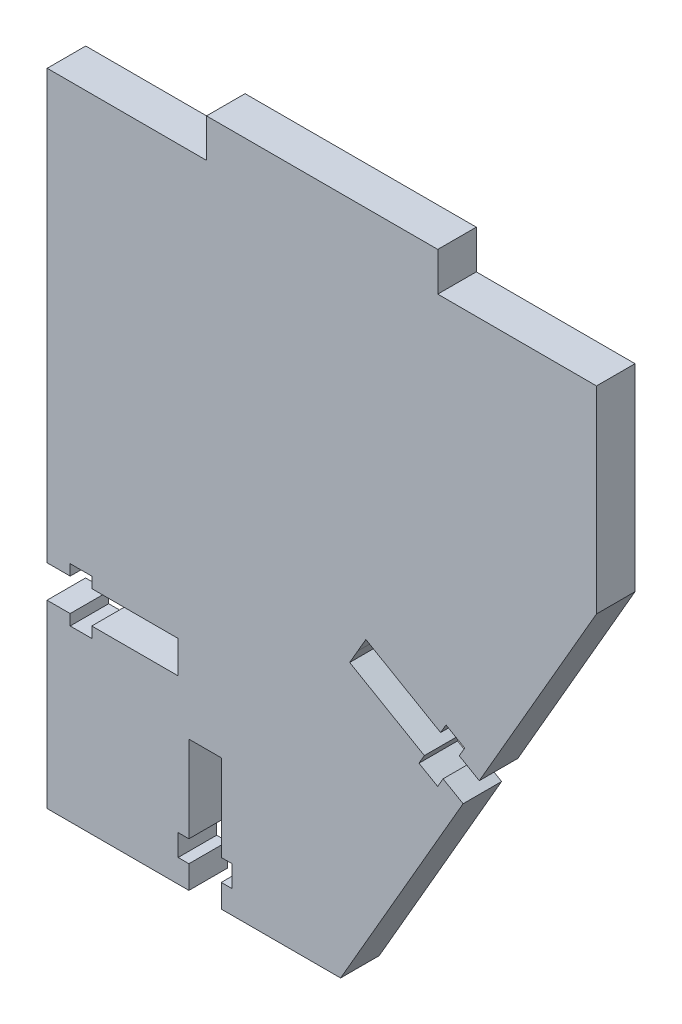
from build123d import *

# Parameters (mm, degrees)
BOSS_EXTRUDE1_DEPTH = 5
CUT_EXTRUDE3_START  = -5
CUT_EXTRUDE3_DEPTH  = 5
BOSS_EXTRUDE2_DEPTH = 5


# Read off the part's stored shape, not the designer's step: Cut-Extrude3
with BuildPart() as part:
    # Sketch1 → Boss-Extrude1 (new body)
    with BuildSketch(Plane.XY):
        Polygon((-35.261138019, -40.918717749), (2.830677256, -40.918717749), (3.530317734, -39.706904894), (36.028317734, 16.581282251), (36.028317734, 42.200866684), (-35.231632156, 42.261282251), align=None)
    extrude(amount=BOSS_EXTRUDE1_DEPTH)

    # Cut-Extrude3 outline → Cut-Extrude3 (cut)
    with BuildSketch(Plane.XY.offset(5).offset(CUT_EXTRUDE3_START)):
        Polygon((16.125363943, -11.891644937), (18.722168425, -13.393847636), (20.82216918, -9.756539633), (18.228446966, -8.256119968), (18.930502063, -7.044872657), (16.506818751, -5.642817308), (15.805791076, -6.854658964), (6.110026049, -1.245840704), (5.056943403, -3.062711671), (4.006943025, -4.881365673), (13.702708053, -10.490183932), (13.001680379, -11.702025589), (15.425363691, -13.104080938), align=None)
        Polygon((-35.251344401, -13.309523063), (-35.25283547, -17.512996385), (-32.25134298, -17.512996385), (-32.2508476, -18.909523063), (-29.4508476, -18.909523063), (-29.4508476, -17.509523063), (-18.251343332, -17.509523063), (-18.25208825, -15.409523063), (-18.251343332, -13.309523063), (-29.4508476, -13.309523063), (-29.4508476, -11.909523063), (-32.2508476, -11.909523063), (-32.251344213, -13.309523063), align=None)
        Polygon((-16.848777516, -40.918717749), (-12.648777516, -40.918717749), (-12.648777516, -37.918717749), (-11.248777516, -37.918717749), (-11.248777516, -35.118717749), (-12.648777516, -35.118717749), (-12.648777516, -23.918717749), (-16.848777516, -23.918717749), (-16.848777516, -35.118717749), (-18.248777516, -35.118717749), (-18.248777516, -37.918717749), (-16.848777516, -37.918717749), align=None)
    extrude(amount=CUT_EXTRUDE3_DEPTH, mode=Mode.SUBTRACT)

    # Sketch3 → Boss-Extrude2 (add)
    with BuildSketch(Plane.XY.offset(5)):
        Polygon((-14.56360213, 47.243759494), (15.43639787, 47.243759494), (15.43639787, 42.218324913), (-14.56360213, 42.243759494), align=None)
    extrude(amount=-BOSS_EXTRUDE2_DEPTH)


solid = part.part
